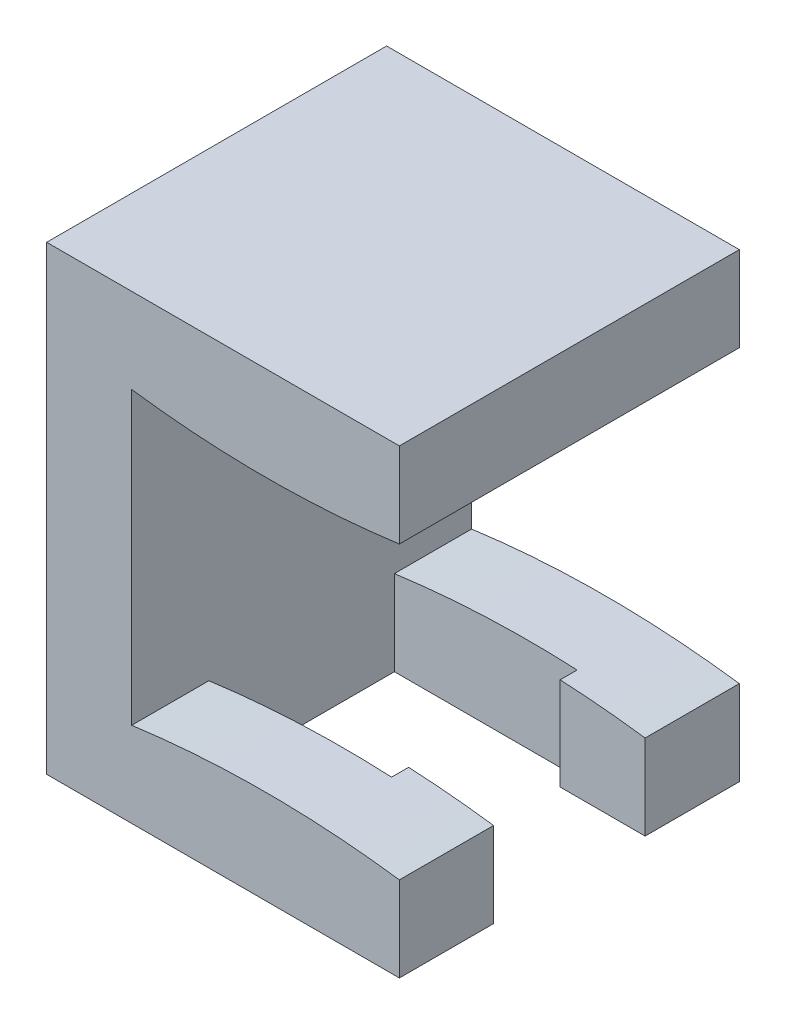
from build123d import *

# Parameters (mm, degrees)
MAINBODY_DEPTH = 6
GRIP_REACH     = 175.119


with BuildPart() as part:
    # Sketch1 → MainBody (new, symmetric)
    with BuildSketch(Plane.XY):
        with BuildLine():
            Line((-159.798174106, 8.133463884), (-172.248174106, 8.133463884))
            Line((-172.248174106, 8.133463884), (-172.248174106, -8.133463884))
            Line((-172.248174106, -8.133463884), (-159.798174106, -8.133463884))
            Line((-159.798174106, -8.133463884), (-159.798174106, -5.133463884))
            ThreePointArc((-159.798174106, -5.133463884), (-164.523174106, -4.8125), (-169.248174106, -5.133463884))
            Line((-169.248174106, -5.133463884), (-169.248174106, -4.7625))
            Line((-169.248174106, -4.7625), (-169.248174106, 4.7625))
            Line((-169.248174106, 4.7625), (-169.248174106, 5.133463884))
            ThreePointArc((-169.248174106, 5.133463884), (-164.523174106, 4.8125), (-159.798174106, 5.133463884))
            Line((-159.798174106, 5.133463884), (-159.798174106, 8.133463884))
        make_face()
    extrude(amount=MAINBODY_DEPTH, both=True)

    # Sketch2 → Grip (cut, up to next)
    with BuildSketch(Plane.XZ.offset(8.133463884), mode=Mode.PRIVATE) as grip_sk1:
        Polygon((-162.798174106, -2.675), (-159.798174106, -2.675), (-159.798174106, 2.675), (-162.798174106, 2.675), (-162.798174106, 3.275), (-169.248174106, 3.275), (-169.248174106, -3.275), (-162.798174106, -3.275), align=None)
    grip_tool1 = extrude(grip_sk1.sketch, amount=-GRIP_REACH, mode=Mode.PRIVATE) & part.part
    add(grip_tool1.solids().sort_by_distance((-164.722325, -8.133464, 0))[0], mode=Mode.SUBTRACT)


solid = part.part
